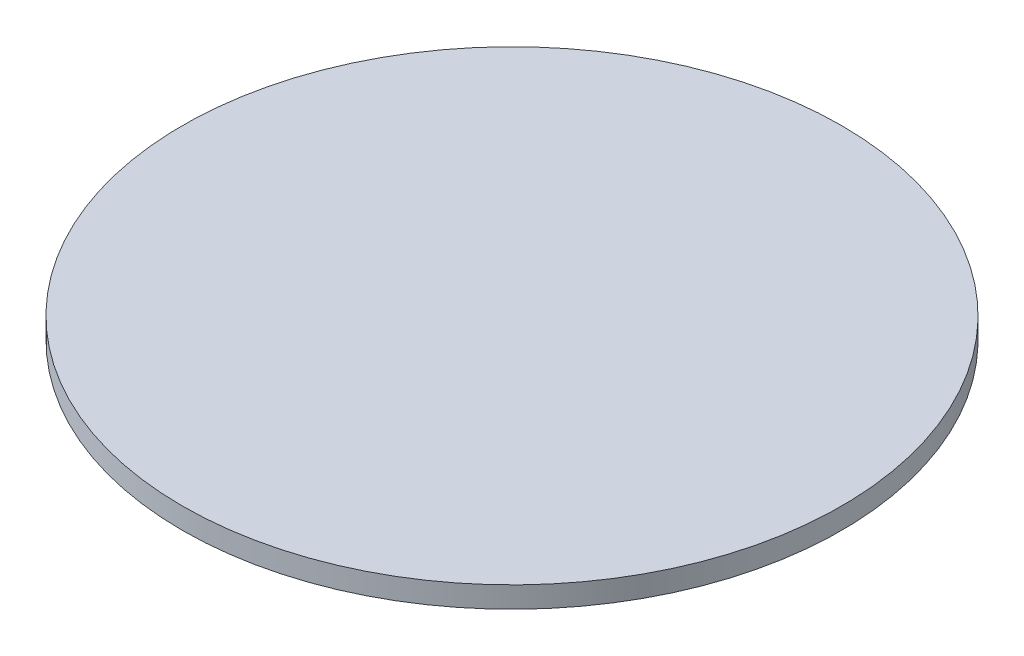
from build123d import *

# Parameters (mm, degrees)
SKETCH1_R           = 49.53
BOSS_EXTRUDE1_DEPTH = 3.175


with BuildPart() as part:
    # Sketch1 → Boss-Extrude1 (new body)
    with BuildSketch(Plane(origin=(0, 0, 0), x_dir=(1, 0, 0), z_dir=(0, 1, 0))):
        Circle(SKETCH1_R)
    extrude(amount=BOSS_EXTRUDE1_DEPTH)


solid = part.part
